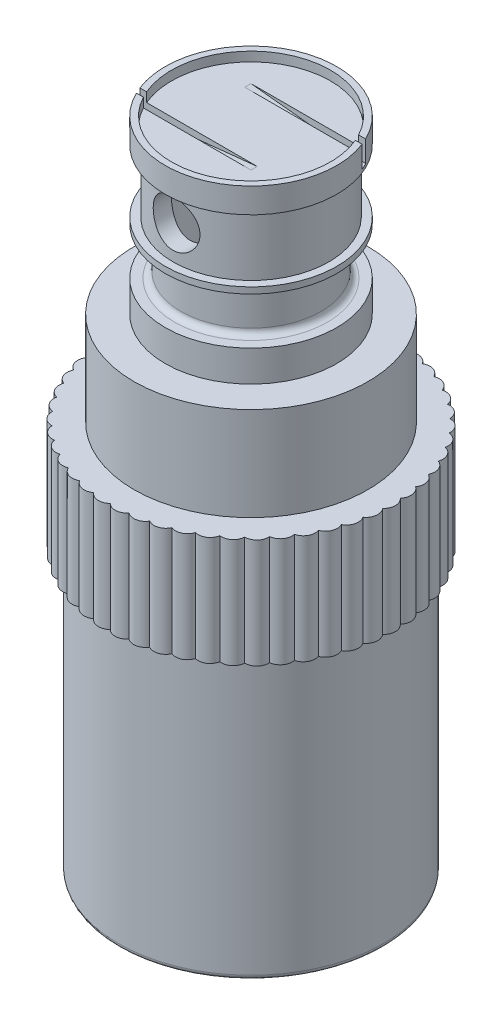
from build123d import *

# Parameters (mm, degrees)
SKETCH1_R                    = 4.25
BOSS_EXTRUDE1_DEPTH          = 12.5
BOSS_EXTRUDE4_START          = -3.5
BOSS_EXTRUDE4_DEPTH          = 3.5
CIRPATTERN5_COUNT            = 50
SKETCH5_R                    = 3.75
BOSS_EXTRUDE5_DEPTH          = 3
SKETCH6_R                    = 2.75
BOSS_EXTRUDE6_DEPTH          = 1
SKETCH7_R                    = 2.25
BOSS_EXTRUDE7_DEPTH          = 1.5
SKETCH8_R                    = 2.75
BOSS_EXTRUDE8_DEPTH          = 0.2
SKETCH9_R                    = 2.5
BOSS_EXTRUDE9_DEPTH          = 2
SKETCH10_R                   = 2.75
BOSS_EXTRUDE10_DEPTH         = 0.8
SKETCH11_R                   = 2.55
CUT_EXTRUDE1_DEPTH           = 0.3
SKETCH12_W                   = 4.125233548
SKETCH12_H                   = 0.2
CUT_REVOLVE1_ANGLE           = 6
CUT_REVOLVE1_OTHER_WAY_ANGLE = 6
SKETCH13_W                   = 4.08419342
SKETCH13_H                   = 0.2
CUT_REVOLVE2_ANGLE           = 6
CUT_REVOLVE2_OTHER_WAY_ANGLE = 6
CUT_EXTRUDE2_DEPTH           = 22.995367972
CUT_EXTRUDE2_DEPTH_BACK      = 22.995367972
SKETCH15_R                   = 0.75
SKETCH16_R                   = 3.95
CUT_EXTRUDE3_DEPTH           = 12.2
SKETCH17_R                   = 3.45
CUT_EXTRUDE4_DEPTH           = 3
CUT_EXTRUDE5_REACH           = 18.548
SKETCH19_R                   = 1.95
FILLET1_R                    = 0.2
FILLET2_R                    = 0.15


with BuildPart() as part:
    # Sketch1 → Boss-Extrude1 (new body)
    with BuildSketch(Plane(origin=(0, 0, 0), x_dir=(1, 0, 0), z_dir=(0, 1, 0))):
        with Locations(Location((0, 0, 0), (0, 0, 270))):
            Circle(SKETCH1_R)
    extrude(amount=BOSS_EXTRUDE1_DEPTH)

    # Sketch4 → Boss-Extrude4 (add)
    with BuildSketch(Plane(origin=(0, 12.5, 0), x_dir=(1, 0, 0), z_dir=(0, 1, 0)).offset(BOSS_EXTRUDE4_START)):
        with BuildLine():
            ThreePointArc((-4.233011765, 0.379620073), (-4.25, 0), (-4.233011765, -0.379620073))
            ThreePointArc((-4.233011765, -0.379620073), (-4.63, 0), (-4.233011765, 0.379620073))
        make_face()
    boss_extrude4 = extrude(amount=BOSS_EXTRUDE4_DEPTH)

    # CirPattern5: Boss-Extrude4 ×50 about axis
    cirpattern5_axis = Axis((0, 0, 0), (0, 1, 0))
    for i in range(1, CIRPATTERN5_COUNT):
        add(boss_extrude4.rotate(cirpattern5_axis, i * 360 / CIRPATTERN5_COUNT))

    # Sketch5 → Boss-Extrude5 (add)
    with BuildSketch(Plane(origin=(0, 12.5, 0), x_dir=(1, 0, 0), z_dir=(0, 1, 0))):
        with Locations(Location((0, 0, 0), (0, 0, 270))):
            Circle(SKETCH5_R)
    extrude(amount=BOSS_EXTRUDE5_DEPTH)

    # Sketch6 → Boss-Extrude6 (add)
    with BuildSketch(Plane(origin=(0, 15.5, 0), x_dir=(1, 0, 0), z_dir=(0, 1, 0))):
        with Locations(Location((0, 0, 0), (0, 0, 270))):
            Circle(SKETCH6_R)
    extrude(amount=BOSS_EXTRUDE6_DEPTH)

    # Sketch7 → Boss-Extrude7 (add)
    with BuildSketch(Plane(origin=(0, 16.5, 0), x_dir=(1, 0, 0), z_dir=(0, 1, 0))):
        with Locations(Location((0, 0, 0), (0, 0, 270))):
            Circle(SKETCH7_R)
    extrude(amount=BOSS_EXTRUDE7_DEPTH)

    # Sketch8 → Boss-Extrude8 (add)
    with BuildSketch(Plane(origin=(0, 18, 0), x_dir=(1, 0, 0), z_dir=(0, 1, 0))):
        with Locations(Location((0, 0, 0), (0, 0, 270))):
            Circle(SKETCH8_R)
    extrude(amount=BOSS_EXTRUDE8_DEPTH)

    # Sketch9 → Boss-Extrude9 (add)
    with BuildSketch(Plane(origin=(0, 18.2, 0), x_dir=(1, 0, 0), z_dir=(0, 1, 0))):
        with Locations(Location((0, 0, 0), (0, 0, 270))):
            Circle(SKETCH9_R)
    extrude(amount=BOSS_EXTRUDE9_DEPTH)

    # Sketch10 → Boss-Extrude10 (add)
    with BuildSketch(Plane(origin=(0, 20.2, 0), x_dir=(1, 0, 0), z_dir=(0, 1, 0))):
        with Locations(Location((0, 0, 0), (0, 0, 270))):
            Circle(SKETCH10_R)
    extrude(amount=BOSS_EXTRUDE10_DEPTH)

    # Sketch11 → Cut-Extrude1 (cut)
    with BuildSketch(Plane(origin=(0, 21, 0), x_dir=(1, 0, 0), z_dir=(0, 1, 0))):
        with Locations(Location((0, 0, 0), (0, 0, 270))):
            Circle(SKETCH11_R)
    extrude(amount=-CUT_EXTRUDE1_DEPTH, mode=Mode.SUBTRACT)

    # Sketch12 → Cut-Revolve1 (revolve, cut)
    with BuildSketch(Plane(origin=(0, 20.7, 0), x_dir=(1, 0, 0), z_dir=(0, 1, 0))):
        with Locations((-0.862616774, -1.1)):
            Rectangle(SKETCH12_W, SKETCH12_H)
    revolve(axis=Axis((1.2, 20.7, -2.474368606), (0, 0, 1)), revolution_arc=CUT_REVOLVE1_ANGLE, mode=Mode.SUBTRACT)

    # Sketch12 → Cut-Revolve1 other way (revolve, cut)
    with BuildSketch(Plane(origin=(0, 20.7, 0), x_dir=(1, 0, 0), z_dir=(0, 1, 0))):
        with Locations((-0.862616774, -1.1)):
            Rectangle(SKETCH12_W, SKETCH12_H)
    revolve(axis=Axis((1.2, 20.7, -2.474368606), (0, 0, -1)), revolution_arc=CUT_REVOLVE1_OTHER_WAY_ANGLE, mode=Mode.SUBTRACT)

    # Sketch13 → Cut-Revolve2 (revolve, cut)
    with BuildSketch(Plane(origin=(0, 20.7, 0), x_dir=(1, 0, 0), z_dir=(0, 1, 0))):
        with Locations((0.84209671, 1.1)):
            Rectangle(SKETCH13_W, SKETCH13_H)
    revolve(axis=Axis((-1.2, 20.7, -2.950120445), (0, 0, 1)), revolution_arc=CUT_REVOLVE2_ANGLE, mode=Mode.SUBTRACT)

    # Sketch13 → Cut-Revolve2 other way (revolve, cut)
    with BuildSketch(Plane(origin=(0, 20.7, 0), x_dir=(1, 0, 0), z_dir=(0, 1, 0))):
        with Locations((0.84209671, 1.1)):
            Rectangle(SKETCH13_W, SKETCH13_H)
    revolve(axis=Axis((-1.2, 20.7, -2.950120445), (0, 0, -1)), revolution_arc=CUT_REVOLVE2_OTHER_WAY_ANGLE, mode=Mode.SUBTRACT)

    # Sketch15 → Cut-Extrude2 (cut, two sides: drawn at the far end of the back side and taken through both)
    with BuildSketch(Plane.XY.offset(-CUT_EXTRUDE2_DEPTH_BACK)):
        with Locations(Location((0, 19.270988454, 0), (0, 0, 89.999999982))):
            Circle(SKETCH15_R)
    extrude(amount=CUT_EXTRUDE2_DEPTH + CUT_EXTRUDE2_DEPTH_BACK, mode=Mode.SUBTRACT)

    # Sketch16 → Cut-Extrude3 (cut)
    with BuildSketch(Plane.XZ):
        with Locations(Location((0, 0, 0), (0, 0, 270))):
            Circle(SKETCH16_R)
    extrude(amount=-CUT_EXTRUDE3_DEPTH, mode=Mode.SUBTRACT)

    # Sketch17 → Cut-Extrude4 (cut)
    with BuildSketch(Plane.XZ.offset(-12.2)):
        with Locations(Location((0, 0, 0), (0, 0, 270))):
            Circle(SKETCH17_R)
    extrude(amount=-CUT_EXTRUDE4_DEPTH, mode=Mode.SUBTRACT)

    # Cut-Extrude5: up to this face of the body (flat: up to its plane)
    cut_extrude5_end = Plane(part.part.faces().sort_by_distance((0, 20.2, -2.672218254))[0])
    # Sketch19 → Cut-Extrude5 (cut, up to the picked face)
    with BuildSketch(Plane.XZ.offset(-15.2), mode=Mode.PRIVATE) as cut_extrude5_sk1:
        with Locations(Location((0, 0, 0), (0, 0, 270))):
            Circle(SKETCH19_R)
    cut_extrude5_tool1 = split(extrude(cut_extrude5_sk1.sketch, amount=-CUT_EXTRUDE5_REACH, mode=Mode.PRIVATE), bisect_by=cut_extrude5_end, keep=Keep.BOTH, mode=Mode.PRIVATE)
    add(cut_extrude5_tool1.solids().sort_by(Axis((0, 15.2, 0), (0, 1, 0)))[0], mode=Mode.SUBTRACT)

    # Fillet1
    fillet1_edges = [part.edges().sort_by_distance(p)[0] for p in [
        (0, 16.5, -2.25),
        (0, 18, -2.25),
    ]]
    fillet(fillet1_edges, radius=FILLET1_R)

    # Fillet2
    fillet2_edges = [part.edges().sort_by_distance(p)[0] for p in [
        (0, 0, -4.25),
        (0, 0, 3.95),
    ]]
    fillet(fillet2_edges, radius=FILLET2_R - 0.0001)  # a hair under: the kernel refuses the full size


solid = part.part
